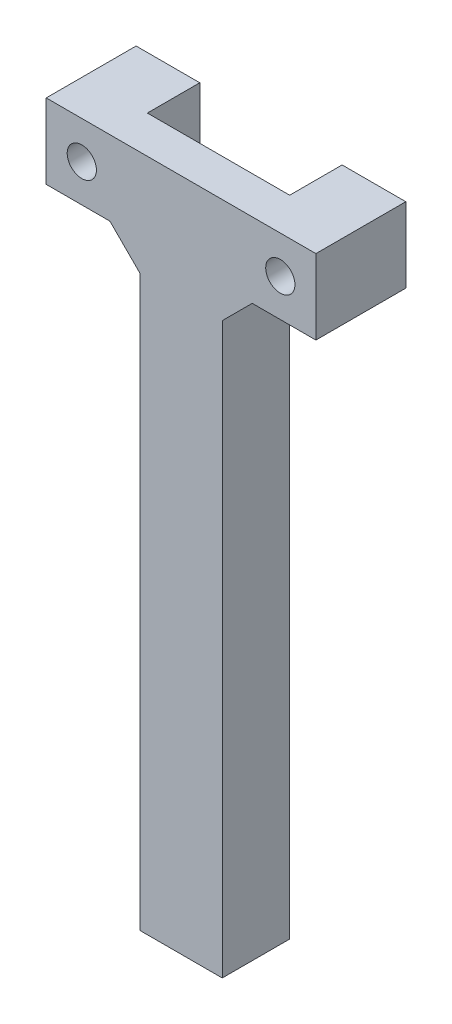
from build123d import *

# Parameters (mm, degrees)
SKETCH1_W                  = 11
SKETCH1_H                  = 9
BOSS_EXTRUDE1_DEPTH        = 80
BOSS_EXTRUDE2_DEPTH        = 10
F_3_9_3_9_DIAMETER_HOLE1_D = 3.9
CHAMFER1_SIZE              = 4
M6X1_0_TAPPED_HOLE1_D      = 5
M6X1_0_TAPPED_HOLE1_DEPTH  = 15
M6X1_0_TAPPED_HOLE1_TIP    = 1.502151548


with BuildPart() as part:
    # Sketch1 → Boss-Extrude1 (new body)
    with BuildSketch(Plane(origin=(0, 0, 0), x_dir=(1, 0, 0), z_dir=(0, 1, 0))):
        with Locations((0, -4.5)):
            Rectangle(SKETCH1_W, SKETCH1_H)
    extrude(amount=-BOSS_EXTRUDE1_DEPTH)

    # Sketch2 → Boss-Extrude2 (add)
    with BuildSketch(Plane(origin=(0, 0, 0), x_dir=(1, 0, 0), z_dir=(0, 1, 0))):
        Polygon((-9.5, 3), (-9.5, -4), (9.5, -4), (9.5, 3), (18, 3), (18, -9), (-18, -9), (-18, 3), align=None)
    extrude(amount=BOSS_EXTRUDE2_DEPTH)

    # Ø3.9 (3.9) Diameter Hole1 (through all)
    with Locations(Plane(origin=(0, 0, -3), x_dir=(-1, 0, 0), z_dir=(0, 0, -1))):
        with Locations((-13.25, 5), (13.25, 5)):
            Hole(F_3_9_3_9_DIAMETER_HOLE1_D / 2)

    # Chamfer1
    chamfer1_edges = [part.edges().sort_by_distance(p)[0] for p in [
        (-5.5, 0, 6.5),
        (5.5, 0, 6.5),
    ]]
    chamfer(chamfer1_edges, length=CHAMFER1_SIZE)
    chamfer1_2_edges = [part.edges().sort_by_distance(p)[0] for p in [
        (0, 0, 0),
    ]]
    chamfer(chamfer1_2_edges, length=CHAMFER1_SIZE - 0.0001)  # a hair under: the kernel refuses the full size

    # M6x1.0 Tapped Hole1
    with Locations(Plane(origin=(0, -80, 0), x_dir=(-1, 0, 0), z_dir=(0, -1, 0))):
        with Locations((0, -4.5)):
            Hole(M6X1_0_TAPPED_HOLE1_D / 2, depth=M6X1_0_TAPPED_HOLE1_DEPTH)
            with Locations((0, 0, -(M6X1_0_TAPPED_HOLE1_DEPTH + M6X1_0_TAPPED_HOLE1_TIP / 2))):  # 118° drill point
                Cone(0, M6X1_0_TAPPED_HOLE1_D / 2, M6X1_0_TAPPED_HOLE1_TIP, mode=Mode.SUBTRACT)


solid = part.part
